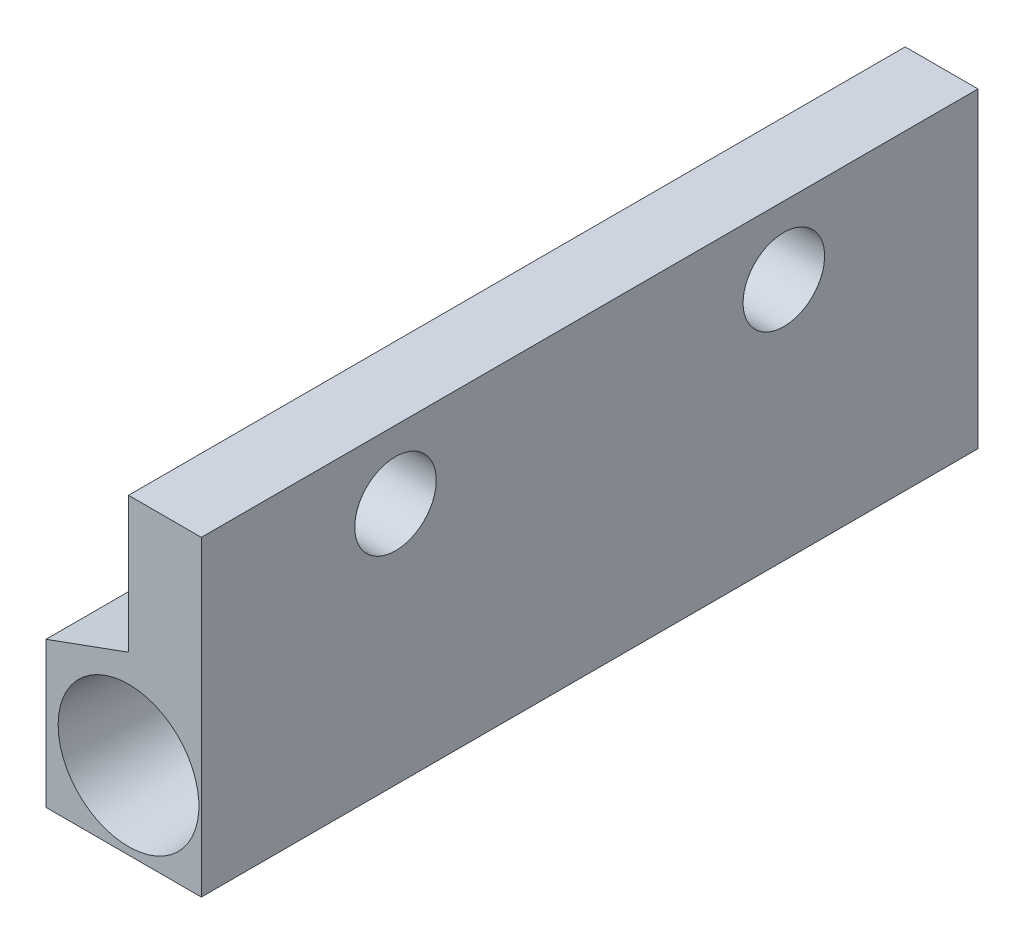
from build123d import *

# Parameters (mm, degrees)
BOSS_EXTRUDE1_DEPTH = 40
SKETCH2_R           = 2.1
CUT_EXTRUDE1_DEPTH  = 42.990351999
CHAMFER1_SIZE       = 10
CHAMFER1_SIZE2      = 0.874886635


with BuildPart() as part:
    # Sketch1 → Boss-Extrude1 (new body)
    with BuildSketch(Plane.XY):
        Polygon((-4.25, -4), (-4.25, 3.5), (0, 5.046873496), (0, 12.046873496), (3.75, 12.046873496), (3.75, -4), align=None)
        with BuildLine():
            ThreePointArc((2.75, 0), (0, 2.75), (-2.75, 0))
            ThreePointArc((-2.75, 0), (0, -2.75), (2.75, 0))
        make_face(mode=Mode.SUBTRACT)
    extrude(amount=BOSS_EXTRUDE1_DEPTH)

    # Sketch2 → Cut-Extrude1 (cut, through all)
    with BuildSketch(Plane.ZY):
        with Locations((10, 8.546873496)):
            Circle(SKETCH2_R)
        with Locations((30, 8.546873496)):
            Circle(SKETCH2_R)
    extrude(amount=-CUT_EXTRUDE1_DEPTH, mode=Mode.SUBTRACT)

    # Chamfer1
    chamfer1_edges = [part.edges().sort_by_distance(p)[0] for p in [
        (-2.75, 0, 40),
    ]]
    chamfer1_side = [part.faces().sort_by_distance(p)[0] for p in [
        (-2.75, 0, 20),
    ]]
    chamfer(chamfer1_edges, length=CHAMFER1_SIZE, length2=CHAMFER1_SIZE2, reference=chamfer1_side[0])

    # Chamfer2: read off the stored shape, not the designer's step
    # Chamfer2 outline → Chamfer2 (revolve, cut)
    with BuildSketch(Plane.XZ):
        Polygon((3.624886635, 0), (2.75, 10), (2.75, 0), align=None)
    revolve(axis=Axis((0, 0, 0), (0, 0, 1)), mode=Mode.SUBTRACT)


solid = part.part
